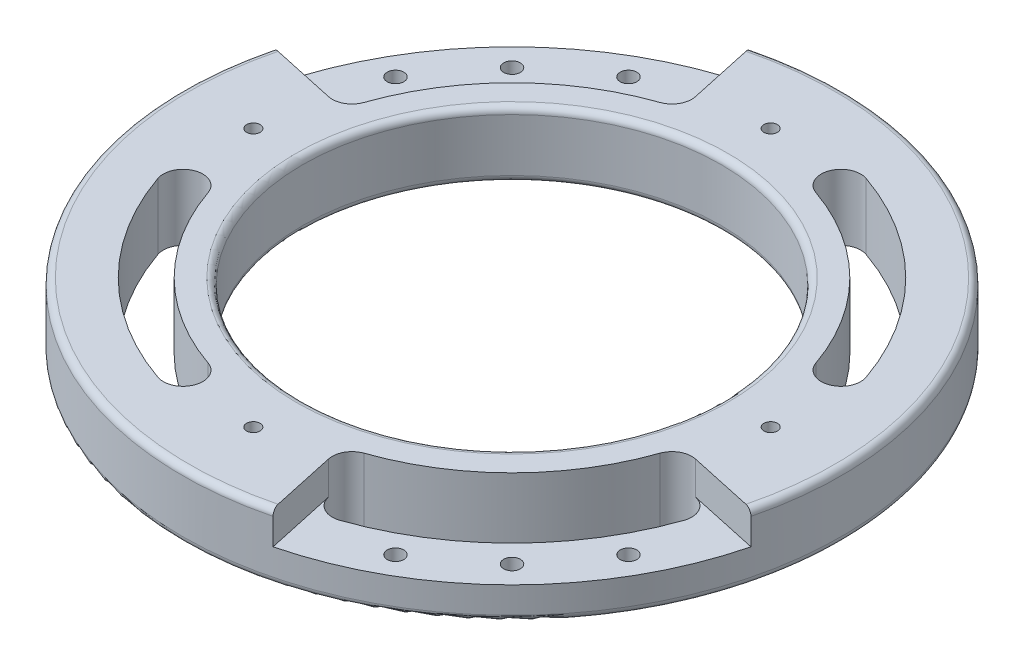
from build123d import *

# Parameters (mm, degrees)
SKETCH1_R           = 100
SKETCH1_R_2         = 2.05
SKETCH1_R_3         = 63.5
BOSS_EXTRUDE1_DEPTH = 20
FILLET1_R           = 2
CUT_EXTRUDE1_START  = -10
CUT_EXTRUDE1_DEPTH  = 10
SKETCH3_R           = 2.525
CUT_EXTRUDE2_DEPTH  = 10


with BuildPart() as part:
    # Sketch1 → Boss-Extrude1 (new body)
    with BuildSketch(Plane(origin=(0, 0, 0), x_dir=(1, 0, 0), z_dir=(0, 1, 0))):
        Circle(SKETCH1_R)
        with Locations((-78.5, 0)):
            Circle(SKETCH1_R_2, mode=Mode.SUBTRACT)
        with Locations((0, 78.5)):
            Circle(SKETCH1_R_2, mode=Mode.SUBTRACT)
        with Locations((78.5, 0)):
            Circle(SKETCH1_R_2, mode=Mode.SUBTRACT)
        with Locations((0, -78.5)):
            Circle(SKETCH1_R_2, mode=Mode.SUBTRACT)
        Circle(SKETCH1_R_3, mode=Mode.SUBTRACT)
        with BuildLine():
            ThreePointArc((-27.60081718, 79.865166944), (-59.75052301, 59.75052301), (-79.865166944, 27.60081718))
            ThreePointArc((-79.865166944, 27.60081718), (-76.154088854, 19.970096414), (-68.523368088, 23.681174504))
            ThreePointArc((-68.523368088, 23.681174504), (-51.265241636, 51.265241636), (-23.681174504, 68.523368088))
            ThreePointArc((-23.681174504, 68.523368088), (-19.970096414, 76.154088854), (-27.60081718, 79.865166944))
        make_face(mode=Mode.SUBTRACT)
        with BuildLine():
            ThreePointArc((79.865166944, 27.60081718), (59.75052301, 59.75052301), (27.60081718, 79.865166944))
            ThreePointArc((27.60081718, 79.865166944), (19.970096414, 76.154088854), (23.681174504, 68.523368088))
            ThreePointArc((23.681174504, 68.523368088), (51.265241636, 51.265241636), (68.523368088, 23.681174504))
            ThreePointArc((68.523368088, 23.681174504), (76.154088854, 19.970096414), (79.865166944, 27.60081718))
        make_face(mode=Mode.SUBTRACT)
        with BuildLine():
            ThreePointArc((27.60081718, -79.865166944), (59.75052301, -59.75052301), (79.865166944, -27.60081718))
            ThreePointArc((79.865166944, -27.60081718), (76.154088854, -19.970096414), (68.523368088, -23.681174504))
            ThreePointArc((68.523368088, -23.681174504), (51.265241636, -51.265241636), (23.681174504, -68.523368088))
            ThreePointArc((23.681174504, -68.523368088), (19.970096414, -76.154088854), (27.60081718, -79.865166944))
        make_face(mode=Mode.SUBTRACT)
        with BuildLine():
            ThreePointArc((-79.865166944, -27.60081718), (-59.75052301, -59.75052301), (-27.60081718, -79.865166944))
            ThreePointArc((-27.60081718, -79.865166944), (-19.970096414, -76.154088854), (-23.681174504, -68.523368088))
            ThreePointArc((-23.681174504, -68.523368088), (-51.265241636, -51.265241636), (-68.523368088, -23.681174504))
            ThreePointArc((-68.523368088, -23.681174504), (-76.154088854, -19.970096414), (-79.865166944, -27.60081718))
        make_face(mode=Mode.SUBTRACT)
    extrude(amount=BOSS_EXTRUDE1_DEPTH)

    # Fillet1
    fillet1_edges = [part.edges().sort_by_distance(p)[0] for p in [
        (-63.5, 0, 0),
        (-100, 0, 0),
        (-63.5, 20, 0),
        (-100, 20, 0),
    ]]
    fillet(fillet1_edges, radius=FILLET1_R)

    # Sketch2 → Cut-Extrude1 (cut)
    with BuildSketch(Plane(origin=(0, 20, 0), x_dir=(1, 0, 0), z_dir=(0, 1, 0)).offset(CUT_EXTRUDE1_START)):
        with BuildLine():
            Line((-19.777543396, 75.467030422), (-24.444340717, 96.966356057))
            ThreePointArc((-24.444340717, 96.966356057), (-70.710678119, 70.710678119), (-96.966356057, 24.444340717))
            Line((-96.966356057, 24.444340717), (-75.467030422, 19.777543396))
            ThreePointArc((-75.467030422, 19.777543396), (-71.253946926, 20.410841463), (-68.523368088, 23.681174504))
            ThreePointArc((-68.523368088, 23.681174504), (-51.265241636, 51.265241636), (-23.681174504, 68.523368088))
            ThreePointArc((-23.681174504, 68.523368088), (-20.410841463, 71.253946926), (-19.777543396, 75.467030422))
        make_face()
        with BuildLine():
            Line((19.777543396, -75.467030422), (24.444340717, -96.966356057))
            ThreePointArc((24.444340717, -96.966356057), (70.710678119, -70.710678119), (96.966356057, -24.444340717))
            Line((96.966356057, -24.444340717), (75.467030422, -19.777543396))
            ThreePointArc((75.467030422, -19.777543396), (71.253946926, -20.410841463), (68.523368088, -23.681174504))
            ThreePointArc((68.523368088, -23.681174504), (51.265241636, -51.265241636), (23.681174504, -68.523368088))
            ThreePointArc((23.681174504, -68.523368088), (20.410841463, -71.253946926), (19.777543396, -75.467030422))
        make_face()
    extrude(amount=CUT_EXTRUDE1_DEPTH, mode=Mode.SUBTRACT)

    # Sketch3 → Cut-Extrude2 (cut)
    with BuildSketch(Plane(origin=(0, 10, 0), x_dir=(1, 0, 0), z_dir=(0, 1, 0))):
        with Locations((-45.111909622, 80.467248681)):
            Circle(SKETCH3_R)
        with Locations((-65.230600564, 65.230600564)):
            Circle(SKETCH3_R)
        with Locations((-80.467248681, 45.111909622)):
            Circle(SKETCH3_R)
        with Locations((45.111909622, -80.467248681)):
            Circle(SKETCH3_R)
        with Locations((65.230600564, -65.230600564)):
            Circle(SKETCH3_R)
        with Locations((80.467248681, -45.111909622)):
            Circle(SKETCH3_R)
    extrude(amount=-CUT_EXTRUDE2_DEPTH, mode=Mode.SUBTRACT)


solid = part.part
